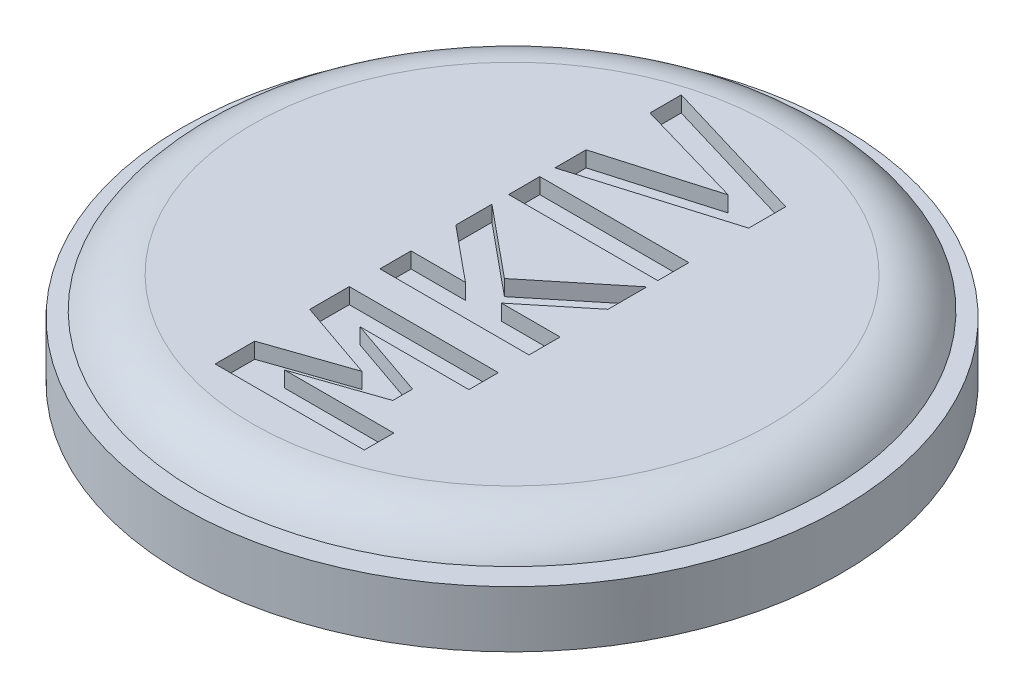
from build123d import *

# Parameters (mm, degrees)
SKETCH1_R           = 17.4
BOSS_EXTRUDE1_DEPTH = 4
SKETCH2_R           = 20
BOSS_EXTRUDE2_DEPTH = 2
CHAMFER1_SIZE       = 0.5
CHAMFER1_SIZE2      = 1.37373871
SKETCH4_R           = 21
SKETCH4_R_2         = 17.9
BOSS_EXTRUDE4_DEPTH = 3.6
FILLET1_R           = 4
SKETCH3_W           = 9.5
SKETCH3_H           = 1.983330026
CUT_EXTRUDE1_DEPTH  = 1
SKETCH5_R           = 14.8
CUT_EXTRUDE2_DEPTH  = 4


with BuildPart() as part:
    # Sketch1 → Boss-Extrude1 (new body)
    with BuildSketch(Plane(origin=(0, 0, 0), x_dir=(1, 0, 0), z_dir=(0, 1, 0))):
        with Locations(Location((0, 0, 0), (0, 0, 270))):
            Circle(SKETCH1_R)
    extrude(amount=BOSS_EXTRUDE1_DEPTH)

    # Sketch2 → Boss-Extrude2 (add)
    with BuildSketch(Plane(origin=(0, 4, 0), x_dir=(1, 0, 0), z_dir=(0, 1, 0))):
        with Locations(Location((0, 0, 0), (0, 0, 270))):
            Circle(SKETCH2_R)
    extrude(amount=BOSS_EXTRUDE2_DEPTH)

    # Chamfer1
    chamfer1_edges = [part.edges().sort_by_distance(p)[0] for p in [
        (0, 0, -17.4),
    ]]
    chamfer1_side = [part.faces().sort_by_distance(p)[0] for p in [
        (0, 0, 0),
    ]]
    chamfer(chamfer1_edges, length=CHAMFER1_SIZE, length2=CHAMFER1_SIZE2, reference=chamfer1_side[0])

    # Fillet1
    # the kernel refuses this fillet: 4 mm, written as the material it takes off along each edge
    with BuildSketch(Plane(origin=(0, 6, 0), x_dir=(0, 0, 1), z_dir=(-1, 0, 0))) as fillet1_piece_1:
        with BuildLine():
            CenterArc((16.535898385, -4), FILLET1_R, 30, 60)
            Line((16.535898385, 0), (16.535898385, 0.08))
            Line((16.535898385, 0.08), (20, 0.08))
            Line((20, 0.08), (20.08, 0))
            ThreePointArc((20.08, 0), (20.08, -1), (20.069282032, -1.96))
            Line((20.069282032, -1.96), (20, -2))
        make_face()
    revolve(axis=Axis((0, 6, 0), (0, 1, 0)), mode=Mode.SUBTRACT)

    # Sketch3 → Cut-Extrude1 (cut)
    with BuildSketch(Plane(origin=(0, 6, 0), x_dir=(1, 0, 0), z_dir=(0, 1, 0))):
        Polygon((-4.5, -14.418733876), (-4.5, -11.89809486), (0.584639809, -10.148541377), (-4.5, -8.389561421), (-4.5, -5.874578289), (5, -5.874578289), (5, -7.748561222), (-1.949196269, -7.748561222), (3.173149434, -9.515082358), (3.173149434, -10.772573923), (-1.949196269, -12.537209764), (5, -12.537209764), (5, -14.418733876), align=None)
        Polygon((-4.5, -3.921412979), (-4.5, -1.938082953), (-1.032943044, -1.938082953), (-4.5, 0.91436793), (-4.5, 3.21631276), (-0.001686843, -0.486406033), (5, 3.593371701), (5, 1.114209168), (1.257690018, -1.938082953), (5, -1.938082953), (5, -3.921412979), align=None)
        with Locations((0.25, 5.275054574)):
            Rectangle(SKETCH3_W, SKETCH3_H)
        Polygon((-4.5, 7.23010518), (-4.5, 9.21909109), (2.511410994, 11.258979956), (-4.5, 13.287557055), (-4.5, 15.282198849), (5, 12.437289145), (5, 10.076900179), align=None)
    extrude(amount=-CUT_EXTRUDE1_DEPTH, mode=Mode.SUBTRACT)

    # Sketch5 → Cut-Extrude2 (cut)
    with BuildSketch(Plane.XZ):
        with Locations(Location((0, 0, 0), (0, 0, 270))):
            Circle(SKETCH5_R)
    extrude(amount=-CUT_EXTRUDE2_DEPTH, mode=Mode.SUBTRACT)


with BuildPart() as body_2:
    # Sketch4 → Boss-Extrude4 (new body)
    with BuildSketch(Plane.XZ):
        with Locations(Location((0, 0, 0), (0, 0, 270))):
            Circle(SKETCH4_R)
        with Locations(Location((0, 0, 0), (0, 0, 270))):
            Circle(SKETCH4_R_2, mode=Mode.SUBTRACT)
    extrude(amount=-BOSS_EXTRUDE4_DEPTH)


solid = Compound([part.part, body_2.part])
